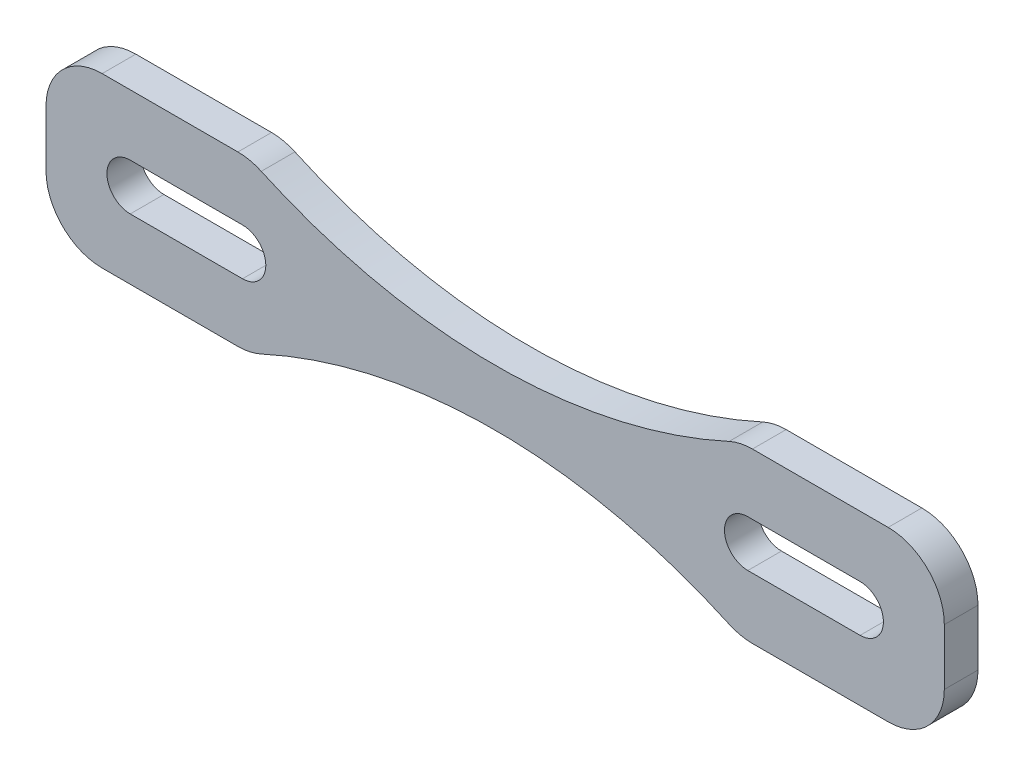
from build123d import *

# Parameters (mm, degrees)
BOSS_EXTRUDE1_DEPTH = 6
FILLET1_R           = 10


with BuildPart() as part:
    # Sketch1 → Boss-Extrude1 (new body)
    with BuildSketch(Plane.XY):
        with BuildLine():
            Line((-80, -15), (-43.588989435, -15))
            ThreePointArc((-43.588989435, -15), (0, -5), (43.588989435, -15))
            Line((43.588989435, -15), (80, -15))
            Line((80, -15), (80, 15))
            Line((80, 15), (43.588989435, 15))
            ThreePointArc((43.588989435, 15), (0, 5), (-43.588989435, 15))
            Line((-43.588989435, 15), (-80, 15))
            Line((-80, 15), (-80, -15))
        make_face()
        with BuildLine():
            Line((-65, 4.15), (-45, 4.15))
            ThreePointArc((-45, 4.15), (-40.85, 0), (-45, -4.15))
            Line((-45, -4.15), (-65, -4.15))
            ThreePointArc((-65, -4.15), (-69.15, 0), (-65, 4.15))
        make_face(mode=Mode.SUBTRACT)
        with BuildLine():
            Line((65, 4.15), (45, 4.15))
            ThreePointArc((45, 4.15), (40.85, 0), (45, -4.15))
            Line((45, -4.15), (65, -4.15))
            ThreePointArc((65, -4.15), (69.15, 0), (65, 4.15))
        make_face(mode=Mode.SUBTRACT)
    extrude(amount=BOSS_EXTRUDE1_DEPTH)

    # Fillet1
    fillet1_edges = [part.edges().sort_by_distance(p)[0] for p in [
        (80, 15, 3),
        (80, -15, 3),
        (43.588989435, -15, 3),
        (-43.588989435, -15, 3),
        (-80, -15, 3),
        (-80, 15, 3),
        (43.588989435, 15, 3),
        (-43.588989435, 15, 3),
    ]]
    fillet(fillet1_edges, radius=FILLET1_R)


solid = part.part
